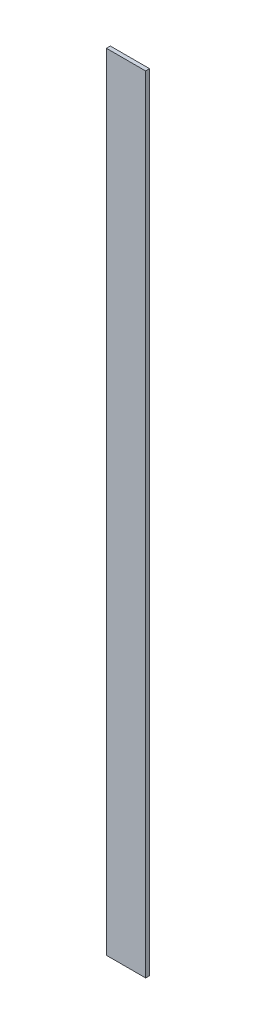
from build123d import *

# Parameters (mm, degrees)
EXTRUDE_1_DEPTH     = 1000
CUT_EXTRUDE_1_DEPTH = 1003.259946321


with BuildPart() as part:
    # Эскиз1 → Вытянуть-Тонкостенный1 (new body)
    with BuildSketch(Plane(origin=(0, 0, 0), x_dir=(1, 0, 0), z_dir=(0, 1, 0))):
        Polygon((0, 45), (0, 0), (45, 0), (45, -5), (-5, -5), (-5, 45), align=None)
    extrude(amount=EXTRUDE_1_DEPTH)

    # Эскиз2 → Вырез-Вытянуть1 (cut, through all)
    with BuildSketch(Plane.ZY.offset(5)):
        Polygon((0, 0), (-45, 45), (-45, 0), align=None)
        Polygon((-45, 1000), (0, 1000), (-45, 955), align=None)
    extrude(amount=-CUT_EXTRUDE_1_DEPTH, mode=Mode.SUBTRACT)


solid = part.part
